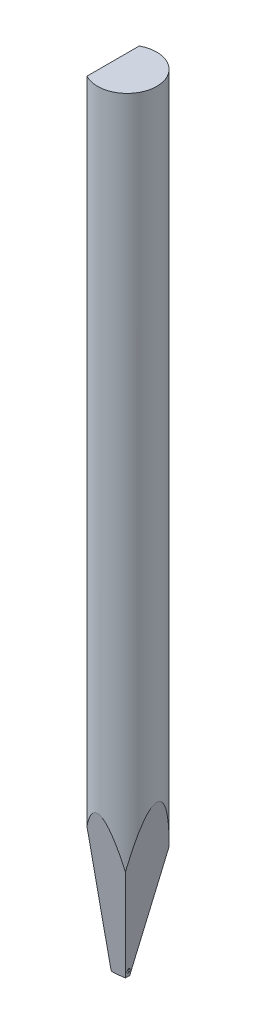
from build123d import *

# Parameters (mm, degrees)
TD_SKETCH_R                             = 0.79248
TL_FEATURE_DEPTH                        = 21.0312
TDF_STD_SKETCH_W                        = 2.09296
TDF_STD_SKETCH_H                        = 2.09296
TDF_STD_FEATURE_DEPTH                   = 22.061040395
ISA_20_STD_FEATURE_DEPTH                = 22.061040395
ISA_20_STD_FEATURE_DEPTH_BACK           = 22.061040395
F_10BA_STD_FEATURE_DEPTH                = 22.061040395
F_10BA_STD_FEATURE_DEPTH_BACK           = 22.061040395
FRO_STD_FEATURE_DEPTH                   = 22.061040395
FRO_STD_FEATURE_DEPTH_BACK              = 22.061040395
C_STD_FEATURE_DEPTH                     = 22.061040395
C_STD_FEATURE_DEPTH_BACK                = 22.061040395
ERW_STD_FEATURE_DEPTH                   = 0.0254
H_STD_FEATURE_REACH                     = 22.907
H_STD_SKETCH_R                          = 0.0254
H_STD_SKETCH_3_R                        = 0.0254
FUNNEL_FINAL_DIAMETRE_STD_FEATURE_DEPTH = 2.499995
FUNNEL_FINAL_DIAMETRE_STD_FEATURE_DRAFT = -22.5
ROUND_BR_STD_FEATURE_START              = -1
ROUND_BR_STD_FEATURE_DEPTH              = 0.984425518


with BuildPart() as part:
    # TD_sketch → TL_feature (new body)
    with BuildSketch(Plane(origin=(0, 0, 0), x_dir=(1, 0, 0), z_dir=(0, 1, 0))):
        with Locations(Location((0, 0, 0), (0, 0, 270))):
            Circle(TD_SKETCH_R)
    extrude(amount=TL_FEATURE_DEPTH)

    # TDF_STD_sketch → TDF_STD_feature (cut, through all)
    with BuildSketch(Plane(origin=(0, 0, 0), x_dir=(1, 0, 0), z_dir=(0, 1, 0))):
        with Locations((-1.4224, 0)):
            Rectangle(TDF_STD_SKETCH_W, TDF_STD_SKETCH_H)
    extrude(amount=TDF_STD_FEATURE_DEPTH, mode=Mode.SUBTRACT)

    # ISA_20_STD_sketch → ISA_20_STD_feature (cut, two sides: drawn at the far end of the back side and taken through both)
    with BuildSketch(Plane(origin=(0, 0, 0), x_dir=(0, 0, -1), z_dir=(1, 0, 0)).offset(-ISA_20_STD_FEATURE_DEPTH_BACK)):
        Polygon((-12.968809457, 73.261672178), (-3.759167997, 21.0312), (-0.0508, 0), (0.0508, 0), (3.759167997, 21.0312), (12.968809457, 73.261672178), (12.968809457, -32.810750623), (-12.968809457, -32.810750623), align=None)
    extrude(amount=ISA_20_STD_FEATURE_DEPTH + ISA_20_STD_FEATURE_DEPTH_BACK, mode=Mode.SUBTRACT)

    # 10BA_STD_sketch → 10BA_STD_feature (cut, two sides: drawn at the far end of the back side and taken through both)
    with BuildSketch(Plane.XY.offset(-F_10BA_STD_FEATURE_DEPTH_BACK)):
        Polygon((-53.226091717, 0), (-0.37592, 0), (-0.24892, 0), (0.011534356, 0.036604473), (3.713447997, 21.0312), (12.890784005, 73.078458855), (91.272293615, 2.163710365), (25.155417893, -70.914748491), align=None)
    extrude(amount=F_10BA_STD_FEATURE_DEPTH + F_10BA_STD_FEATURE_DEPTH_BACK, mode=Mode.SUBTRACT)

    # FRO_STD_sketch → FRO_STD_feature (cut, two sides: drawn at the far end of the back side and taken through both)
    with BuildSketch(Plane.XY.offset(-FRO_STD_FEATURE_DEPTH_BACK)):
        with BuildLine():
            Line((-0.37592, 52.149873762), (-0.37592, 0.0254))
            ThreePointArc((-0.37592, 0.0254), (-0.368480512, 0.007439488), (-0.35052, 0))
            Line((-0.35052, 0), (51.773953762, 0))
            Line((51.773953762, 0), (-21.941183964, -73.715137726))
            Line((-21.941183964, -73.715137726), (-74.091057726, -21.565263964))
            Line((-74.091057726, -21.565263964), (-0.37592, 52.149873762))
        make_face()
    extrude(amount=FRO_STD_FEATURE_DEPTH + FRO_STD_FEATURE_DEPTH_BACK, mode=Mode.SUBTRACT)

    # C_STD_sketch → C_STD_feature (cut, two sides: drawn at the far end of the back side and taken through both)
    with BuildSketch(Plane(origin=(0, 0, 0), x_dir=(0, 0, -1), z_dir=(1, 0, 0)).offset(-C_STD_FEATURE_DEPTH_BACK)):
        with BuildLine():
            Line((-51.498419713, -8.177529753), (-0.048243287, 0))
            ThreePointArc((-0.048243287, 0), (0, 0.00381), (0.048243287, 0))
            Line((0.048243287, 0), (51.498419713, -8.177529753))
            Line((51.498419713, -8.177529753), (51.498419713, -112.369518834))
            Line((51.498419713, -112.369518834), (-51.498419713, -112.369518834))
            Line((-51.498419713, -112.369518834), (-51.498419713, -8.177529753))
        make_face()
    extrude(amount=C_STD_FEATURE_DEPTH + C_STD_FEATURE_DEPTH_BACK, mode=Mode.SUBTRACT)


with BuildPart() as body_2:
    # ERW_STD_sketch → ERW_STD_feature (new, symmetric)
    with BuildSketch(Plane.XY):
        Polygon((-0.127, 0.0762), (-0.127, 0), (-0.29718, 0), (-0.239759181, 0.0762), align=None)
    extrude(amount=ERW_STD_FEATURE_DEPTH, both=True)

    # H_STD_sketch → H_STD_feature (add, up to next)
    with BuildSketch(Plane(origin=(0.008335492, 0.154335983, 0), x_dir=(0, 0, -1), z_dir=(0.8660254037844415, 0.4999999999999953, 0)), mode=Mode.PRIVATE) as h_std_feature_sk1:
        with Locations(Location((0, 0, 0), (0, 0, 90))):
            Circle(H_STD_SKETCH_R)
    h_std_feature_tool1 = extrude(h_std_feature_sk1.sketch, amount=-H_STD_FEATURE_REACH, mode=Mode.PRIVATE) - body_2.part
    add(h_std_feature_tool1.solids().sort_by_distance((0.008335, 0.154336, 0))[0])


with BuildPart() as funnel_final_diametre_std_feature_tool:
    # H_STD_sketch<3> → funnel_final_diametre_STD_feature (with draft: the straight prism first)
    with BuildSketch(Plane(origin=(0.008335492, 0.154335983, 0), x_dir=(0, 0, -1), z_dir=(0.8660254037844415, 0.4999999999999953, 0))):
        with Locations(Location((0, 0, 0), (0, 0, 90))):
            Circle(H_STD_SKETCH_3_R)
    extrude(amount=FUNNEL_FINAL_DIAMETRE_STD_FEATURE_DEPTH)
    # funnel_final_diametre_STD_feature: the draft: its side faces are tilted about the plane it starts from
    funnel_final_diametre_std_feature_sides = [funnel_final_diametre_std_feature_tool.faces().sort_by_distance(p)[0] for p in [
        (1.103565082, 0.757337687, 0),
    ]]
    draft(funnel_final_diametre_std_feature_sides, Plane(origin=(0.008335492, 0.154335983, 0), x_dir=(0, 0, -1), z_dir=(0.8660254037844415, 0.4999999999999953, 0)), FUNNEL_FINAL_DIAMETRE_STD_FEATURE_DRAFT)


with BuildPart() as body_2_1:
    add(body_2.part)

    # funnel_final_diametre_STD_feature: add funnel_final_diametre_std_feature_tool
    add(funnel_final_diametre_std_feature_tool.part)

    # ROUND_BR_STD_feature: read off the stored shape, not the designer's step
    # ROUND_BR_STD_feature outline → ROUND_BR_STD_feature (cut)
    with BuildSketch(Plane(origin=(0, 0, 0), x_dir=(0.79863551004729, -0.601815023152052, 0), z_dir=(0.601815023152052, 0.79863551004729, 0)).offset(ROUND_BR_STD_FEATURE_START)):
        with BuildLine():
            Line((-0.237338501, -0.0254), (-0.211938501, -0.0254))
            ThreePointArc((-0.211938501, -0.0254), (-0.229899013, -0.017960512), (-0.237338501, 0))
            Line((-0.237338501, 0), (-0.237338501, -0.0254))
        make_face()
        with BuildLine():
            Line((-0.237338501, 0.0254), (-0.237338501, 0))
            ThreePointArc((-0.237338501, 0), (-0.229899013, 0.017960512), (-0.211938501, 0.0254))
            Line((-0.211938501, 0.0254), (-0.237338501, 0.0254))
        make_face()
    extrude(amount=ROUND_BR_STD_FEATURE_DEPTH, mode=Mode.SUBTRACT)


with BuildPart() as part_1:
    add(part.part)

    # COMBINE_STD_feature: cut body 2
    add(body_2_1.part, mode=Mode.SUBTRACT)


solid = part_1.part
